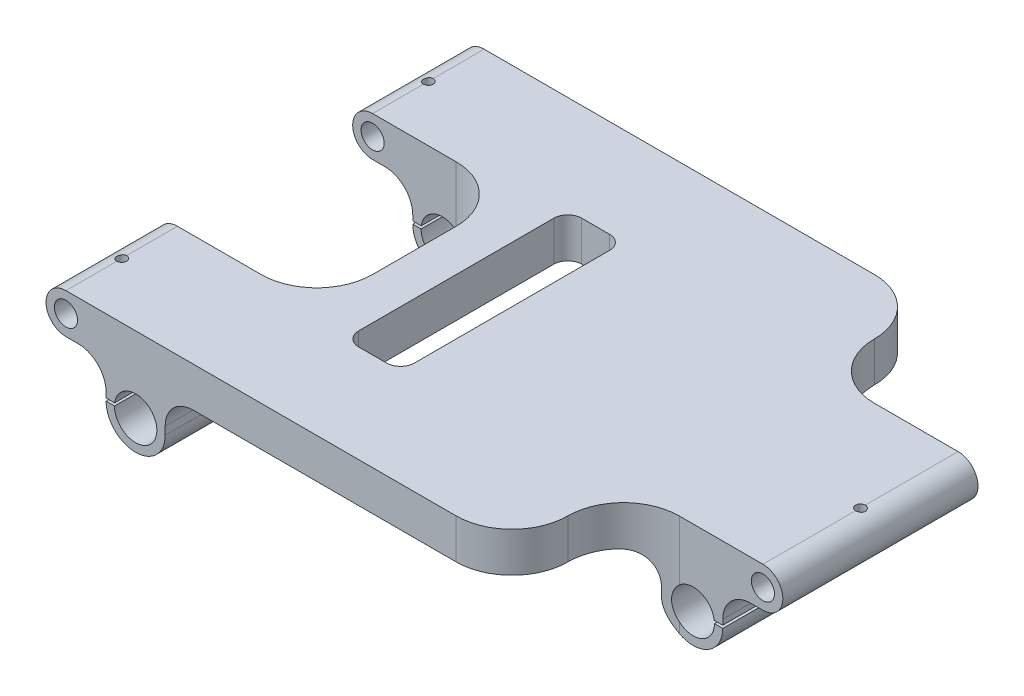
from build123d import *

# Parameters (mm, degrees)
SKETCH5_R               = 7.6
SKETCH5_R_2             = 4.15
BOSS_EXTRUDE4_DEPTH     = 150
SKETCH7_W               = 89.175042466
SKETCH7_H               = 70
SKETCH7_W_2             = 124.051198178
SKETCH7_H_2             = 59.101732651
SKETCH7_W_3             = 92.104965072
SKETCH7_H_3             = 69.542958169
CUT_EXTRUDE3_DEPTH      = 150
FILLET2_R               = 20
FILLET3_R               = 20
FILLET4_R               = 20
CUT_EXTRUDE4_START      = -12.85
CUT_EXTRUDE4_DEPTH      = 12.85
FILLET6_R               = 10
SKETCH12_R              = 1.75
CUT_EXTRUDE8_DEPTH      = 208
CUT_EXTRUDE9_DEPTH      = 20
SKETCH15_W              = 150
SKETCH15_H              = 1
CUT_EXTRUDE_THIN1_DEPTH = 10
SKETCH16_W              = 70
SKETCH16_H              = 1
CUT_EXTRUDE_THIN2_DEPTH = 10


with BuildPart() as part:
    # Sketch5 → Boss-Extrude4 (new body)
    with BuildSketch(Plane.XY):
        with BuildLine():
            Line((-90.6, 0), (-90.6, 12.85))
            Line((-90.6, 12.85), (-105, 12.85))
            ThreePointArc((-105, 12.85), (-112.15, 20), (-105, 27.15))
            Line((-105, 27.15), (105, 27.15))
            ThreePointArc((105, 27.15), (112.15, 20), (105, 12.85))
            Line((105, 12.85), (90.6, 12.85))
            Line((90.6, 12.85), (90.6, 0))
            ThreePointArc((90.6, 0), (87.495331881, -7.495331881), (80, -10.6))
            ThreePointArc((80, -10.6), (72.504668119, -7.495331881), (69.4, 0))
            Line((69.4, 0), (-69.4, 0))
            ThreePointArc((-69.4, 0), (-72.504668119, -7.495331881), (-80, -10.6))
            ThreePointArc((-80, -10.6), (-87.495331881, -7.495331881), (-90.6, 0))
        make_face()
        with Locations((-80, 0)):
            Circle(SKETCH5_R, mode=Mode.SUBTRACT)
        with Locations((80, 0)):
            Circle(SKETCH5_R, mode=Mode.SUBTRACT)
        with Locations((-105, 20)):
            Circle(SKETCH5_R_2, mode=Mode.SUBTRACT)
        with Locations((105, 20)):
            Circle(SKETCH5_R_2, mode=Mode.SUBTRACT)
    extrude(amount=BOSS_EXTRUDE4_DEPTH)

    # Sketch7 → Cut-Extrude3 (cut)
    with BuildSketch(Plane(origin=(0, 27.15, 0), x_dir=(1, 0, 0), z_dir=(0, 1, 0))):
        with Locations((-99.587521233, -75)):
            Rectangle(SKETCH7_W, SKETCH7_H)
        with Locations((117.025599089, -139.550866326)):
            Rectangle(SKETCH7_W_2, SKETCH7_H_2)
        with Locations((101.052482536, -5.228520915)):
            Rectangle(SKETCH7_W_3, SKETCH7_H_3)
    extrude(amount=-CUT_EXTRUDE3_DEPTH, mode=Mode.SUBTRACT)

    # Fillet2
    fillet2_edges = [part.edges().sort_by_distance(p)[0] for p in [
        (55, 13.575, 0),
        (55, 13.575, 150),
    ]]
    fillet(fillet2_edges, radius=FILLET2_R)

    # Fillet3
    # the kernel refuses this fillet: 20 mm, written as the material it adds along each edge
    with BuildSketch(Plane(origin=(55, 27.15, 40), x_dir=(0, 0, -1), z_dir=(0, -1, 0))) as fillet3_piece_1_section:
        with BuildLine():
            CenterArc((FILLET3_R, FILLET3_R), FILLET3_R, 180, 90)
            Line((0, FILLET3_R), (0, 0))
            Line((0, 0), (FILLET3_R, 0))
        make_face()
    fillet3_piece_1 = extrude(amount=27.15, mode=Mode.PRIVATE)
    fillet3_piece_1 = fillet3_piece_1 - Plane(origin=(80, 0, 35.43535288), x_dir=(1, 0, 0), z_dir=(0, 0, -1)) * Cylinder(10.6, 135, mode=Mode.PRIVATE)
    add(fillet3_piece_1)
    with BuildSketch(Plane(origin=(55, 27.15, 40), x_dir=(0, 0, -1), z_dir=(0, -1, 0))) as fillet3_piece_2_section:
        with BuildLine():
            CenterArc((FILLET3_R, FILLET3_R), FILLET3_R, 180, 90)
            Line((0, FILLET3_R), (0, 0))
            Line((0, 0), (FILLET3_R, 0))
        make_face()
    fillet3_piece_2 = extrude(amount=27.15, mode=Mode.PRIVATE)
    fillet3_piece_2 = fillet3_piece_2 & Plane(origin=(80, 0, 40.045862932), x_dir=(1, 0, 0), z_dir=(0, 0, -1)) * Cylinder(10.6, 135, mode=Mode.PRIVATE)
    fillet3_piece_2 = fillet3_piece_2 - Plane(origin=(80, 0, 40.045862932), x_dir=(1, 0, 0), z_dir=(0, 0, -1)) * Cylinder(7.6, 135, mode=Mode.PRIVATE)
    add(fillet3_piece_2)
    with BuildSketch(Plane(origin=(55, 27.15, 40), x_dir=(0, 0, -1), z_dir=(0, -1, 0))) as fillet3_piece_3_section:
        with BuildLine():
            CenterArc((FILLET3_R, FILLET3_R), FILLET3_R, 180, 90)
            Line((0, FILLET3_R), (0, 0))
            Line((0, 0), (FILLET3_R, 0))
        make_face()
    fillet3_piece_3 = extrude(amount=77.15, mode=Mode.PRIVATE)
    fillet3_piece_3 = split(fillet3_piece_3, bisect_by=Plane(origin=(71.797755261, 0, 40.045862905), z_dir=(0, -1, 0)), keep=Keep.TOP, mode=Mode.PRIVATE)
    fillet3_piece_3 = fillet3_piece_3 & Plane(origin=(80, 0, 40.045862905), x_dir=(1, 0, 0), z_dir=(0, 0, -1)) * Cylinder(10.6, 235, mode=Mode.PRIVATE)
    fillet3_piece_3 = fillet3_piece_3 - Plane(origin=(80, 0, 40.045862905), x_dir=(1, 0, 0), z_dir=(0, 0, -1)) * Cylinder(7.6, 235, mode=Mode.PRIVATE)
    add(fillet3_piece_3)
    with BuildSketch(Plane(origin=(55, 27.15, 110), x_dir=(1, 0, 0), z_dir=(0, -1, 0))) as fillet3_piece_4_section:
        with BuildLine():
            CenterArc((FILLET3_R, FILLET3_R), FILLET3_R, 180, 90)
            Line((0, FILLET3_R), (0, 0))
            Line((0, 0), (FILLET3_R, 0))
        make_face()
    fillet3_piece_4 = extrude(amount=27.15, mode=Mode.PRIVATE)
    fillet3_piece_4 = fillet3_piece_4 - Plane(origin=(80, 0, 114.564647062), x_dir=(1, 0, 0), z_dir=(0, 0, -1)) * Cylinder(10.6, 135, mode=Mode.PRIVATE)
    add(fillet3_piece_4)
    with BuildSketch(Plane(origin=(55, 27.15, 110), x_dir=(1, 0, 0), z_dir=(0, -1, 0))) as fillet3_piece_5_section:
        with BuildLine():
            CenterArc((FILLET3_R, FILLET3_R), FILLET3_R, 180, 90)
            Line((0, FILLET3_R), (0, 0))
            Line((0, 0), (FILLET3_R, 0))
        make_face()
    fillet3_piece_5 = extrude(amount=27.15, mode=Mode.PRIVATE)
    fillet3_piece_5 = fillet3_piece_5 & Plane(origin=(80, 0, 109.954137067), x_dir=(1, 0, 0), z_dir=(0, 0, -1)) * Cylinder(10.6, 135, mode=Mode.PRIVATE)
    fillet3_piece_5 = fillet3_piece_5 - Plane(origin=(80, 0, 109.954137067), x_dir=(1, 0, 0), z_dir=(0, 0, -1)) * Cylinder(7.6, 135, mode=Mode.PRIVATE)
    add(fillet3_piece_5)
    with BuildSketch(Plane(origin=(55, 27.15, 110), x_dir=(1, 0, 0), z_dir=(0, -1, 0))) as fillet3_piece_6_section:
        with BuildLine():
            CenterArc((FILLET3_R, FILLET3_R), FILLET3_R, 180, 90)
            Line((0, FILLET3_R), (0, 0))
            Line((0, 0), (FILLET3_R, 0))
        make_face()
    fillet3_piece_6 = extrude(amount=77.15, mode=Mode.PRIVATE)
    fillet3_piece_6 = split(fillet3_piece_6, bisect_by=Plane(origin=(71.797755212, 0, 109.954137092), z_dir=(0, -1, 0)), keep=Keep.TOP, mode=Mode.PRIVATE)
    fillet3_piece_6 = fillet3_piece_6 & Plane(origin=(80, 0, 109.954137092), x_dir=(1, 0, 0), z_dir=(0, 0, -1)) * Cylinder(10.6, 235, mode=Mode.PRIVATE)
    fillet3_piece_6 = fillet3_piece_6 - Plane(origin=(80, 0, 109.954137092), x_dir=(1, 0, 0), z_dir=(0, 0, -1)) * Cylinder(7.6, 235, mode=Mode.PRIVATE)
    add(fillet3_piece_6)

    # Fillet4
    # the kernel refuses this fillet: 20 mm, written as the material it adds along each edge
    with BuildSketch(Plane(origin=(-55, 27.15, 40), x_dir=(-1, 0, 0), z_dir=(0, -1, 0))) as fillet4_piece_1_section:
        with BuildLine():
            CenterArc((FILLET4_R, -FILLET4_R), FILLET4_R, 90, 90)
            Line((0, -FILLET4_R), (0, 0))
            Line((0, 0), (FILLET4_R, 0))
        make_face()
    fillet4_piece_1 = extrude(amount=27.15, mode=Mode.PRIVATE)
    fillet4_piece_1 = fillet4_piece_1 - Plane(origin=(-80, 0, 44.564647072), x_dir=(0, -1, 0), z_dir=(0, 0, -1)) * Cylinder(10.6, 135, mode=Mode.PRIVATE)
    add(fillet4_piece_1)
    with BuildSketch(Plane(origin=(-55, 27.15, 40), x_dir=(-1, 0, 0), z_dir=(0, -1, 0))) as fillet4_piece_2_section:
        with BuildLine():
            CenterArc((FILLET4_R, -FILLET4_R), FILLET4_R, 90, 90)
            Line((0, -FILLET4_R), (0, 0))
            Line((0, 0), (FILLET4_R, 0))
        make_face()
    fillet4_piece_2 = extrude(amount=27.15, mode=Mode.PRIVATE)
    fillet4_piece_2 = fillet4_piece_2 & Plane(origin=(-80, 0, 39.954137092), x_dir=(0, -1, 0), z_dir=(0, 0, -1)) * Cylinder(10.6, 135, mode=Mode.PRIVATE)
    fillet4_piece_2 = fillet4_piece_2 - Plane(origin=(-80, 0, 39.954137092), x_dir=(1, 0, 0), z_dir=(0, 0, -1)) * Cylinder(7.6, 135, mode=Mode.PRIVATE)
    add(fillet4_piece_2)
    with BuildSketch(Plane(origin=(-55, 27.15, 40), x_dir=(-1, 0, 0), z_dir=(0, -1, 0))) as fillet4_piece_3_section:
        with BuildLine():
            CenterArc((FILLET4_R, -FILLET4_R), FILLET4_R, 90, 90)
            Line((0, -FILLET4_R), (0, 0))
            Line((0, 0), (FILLET4_R, 0))
        make_face()
    fillet4_piece_3 = extrude(amount=77.15, mode=Mode.PRIVATE)
    fillet4_piece_3 = split(fillet4_piece_3, bisect_by=Plane(origin=(-71.797755148, 0, 39.954137066), z_dir=(0, -1, 0)), keep=Keep.TOP, mode=Mode.PRIVATE)
    fillet4_piece_3 = fillet4_piece_3 & Plane(origin=(-80, 0, 39.954137066), x_dir=(0, -1, 0), z_dir=(0, 0, -1)) * Cylinder(10.6, 235, mode=Mode.PRIVATE)
    fillet4_piece_3 = fillet4_piece_3 - Plane(origin=(-80, 0, 39.954137066), x_dir=(1, 0, 0), z_dir=(0, 0, -1)) * Cylinder(7.6, 235, mode=Mode.PRIVATE)
    add(fillet4_piece_3)
    with BuildSketch(Plane(origin=(-55, 27.15, 110), x_dir=(0, 0, -1), z_dir=(0, -1, 0))) as fillet4_piece_4_section:
        with BuildLine():
            CenterArc((FILLET4_R, -FILLET4_R), FILLET4_R, 90, 90)
            Line((0, -FILLET4_R), (0, 0))
            Line((0, 0), (FILLET4_R, 0))
        make_face()
    fillet4_piece_4 = extrude(amount=27.15, mode=Mode.PRIVATE)
    fillet4_piece_4 = fillet4_piece_4 - Plane(origin=(-80, 0, 105.435352744), x_dir=(0, -1, 0), z_dir=(0, 0, -1)) * Cylinder(10.6, 135, mode=Mode.PRIVATE)
    add(fillet4_piece_4)
    with BuildSketch(Plane(origin=(-55, 27.15, 110), x_dir=(0, 0, -1), z_dir=(0, -1, 0))) as fillet4_piece_5_section:
        with BuildLine():
            CenterArc((FILLET4_R, -FILLET4_R), FILLET4_R, 90, 90)
            Line((0, -FILLET4_R), (0, 0))
            Line((0, 0), (FILLET4_R, 0))
        make_face()
    fillet4_piece_5 = extrude(amount=27.15, mode=Mode.PRIVATE)
    fillet4_piece_5 = fillet4_piece_5 & Plane(origin=(-80, 0, 110.045862902), x_dir=(0, -1, 0), z_dir=(0, 0, -1)) * Cylinder(10.6, 135, mode=Mode.PRIVATE)
    fillet4_piece_5 = fillet4_piece_5 - Plane(origin=(-80, 0, 110.045862902), x_dir=(1, 0, 0), z_dir=(0, 0, -1)) * Cylinder(7.6, 135, mode=Mode.PRIVATE)
    add(fillet4_piece_5)
    with BuildSketch(Plane(origin=(-55, 27.15, 110), x_dir=(0, 0, -1), z_dir=(0, -1, 0))) as fillet4_piece_6_section:
        with BuildLine():
            CenterArc((FILLET4_R, -FILLET4_R), FILLET4_R, 90, 90)
            Line((0, -FILLET4_R), (0, 0))
            Line((0, 0), (FILLET4_R, 0))
        make_face()
    fillet4_piece_6 = extrude(amount=77.15, mode=Mode.PRIVATE)
    fillet4_piece_6 = split(fillet4_piece_6, bisect_by=Plane(origin=(-71.797755205, 0, 110.04586293), z_dir=(0, -1, 0)), keep=Keep.TOP, mode=Mode.PRIVATE)
    fillet4_piece_6 = fillet4_piece_6 & Plane(origin=(-80, 0, 110.04586293), x_dir=(0, -1, 0), z_dir=(0, 0, -1)) * Cylinder(10.6, 235, mode=Mode.PRIVATE)
    fillet4_piece_6 = fillet4_piece_6 - Plane(origin=(-80, 0, 110.04586293), x_dir=(1, 0, 0), z_dir=(0, 0, -1)) * Cylinder(7.6, 235, mode=Mode.PRIVATE)
    add(fillet4_piece_6)

    # Sketch8 → Cut-Extrude4 (cut)
    with BuildSketch(Plane.XZ.offset(CUT_EXTRUDE4_START)):
        with BuildLine():
            Line((-69.4, 0), (35, 0))
            ThreePointArc((35, 0), (49.142135624, 5.857864376), (55, 20))
            ThreePointArc((55, 20), (59, 32), (69.4, 39.2))
            Line((69.4, 39.2), (69.4, 110.8))
            ThreePointArc((69.4, 110.8), (59, 118), (55, 130))
            ThreePointArc((55, 130), (49.142135624, 144.142135624), (35, 150))
            Line((35, 150), (-69.4, 150))
            Line((-69.4, 150), (-69.4, 109.2))
            ThreePointArc((-69.4, 109.2), (-59, 102), (-55, 90))
            Line((-55, 90), (-55, 60))
            ThreePointArc((-55, 60), (-59, 48), (-69.4, 40.8))
            Line((-69.4, 40.8), (-69.4, 0))
        make_face()
    extrude(amount=CUT_EXTRUDE4_DEPTH, mode=Mode.SUBTRACT)

    # Fillet6
    fillet6_edges = [part.edges().sort_by_distance(p)[0] for p in [
        (69.4, 12.85, 75),
        (-69.4, 12.85, 129.6),
        (-69.4, 12.85, 20.4),
        (-90.6, 12.85, 130),
        (-90.6, 12.85, 20),
        (90.6, 12.85, 75),
    ]]
    fillet(fillet6_edges, radius=FILLET6_R)

    # Sketch12 → Cut-Extrude8 (cut)
    with BuildSketch(Plane(origin=(0, 27.15, 0), x_dir=(1, 0, 0), z_dir=(0, 1, 0))):
        with Locations(Location((-105, -20, 0), (0, 0, 270))):
            Circle(SKETCH12_R)
        with Locations(Location((-105, -130, 0), (0, 0, 270))):
            Circle(SKETCH12_R)
        with Locations(Location((105, -75, 0), (0, 0, 270))):
            Circle(SKETCH12_R)
    extrude(amount=-CUT_EXTRUDE8_DEPTH, mode=Mode.SUBTRACT)

    # Sketch13 → Cut-Extrude9 (cut)
    with BuildSketch(Plane(origin=(0, 12.85, 0), x_dir=(-1, 0, 0), z_dir=(0, -1, 0))):
        with BuildLine():
            Line((25, -35), (35, -35))
            ThreePointArc((35, -35), (38.535533906, -36.464466094), (40, -40))
            Line((40, -40), (40, -110))
            ThreePointArc((40, -110), (38.535533906, -113.535533906), (35, -115))
            Line((35, -115), (25, -115))
            ThreePointArc((25, -115), (21.464466094, -113.535533906), (20, -110))
            Line((20, -110), (20, -40))
            ThreePointArc((20, -40), (21.464466094, -36.464466094), (25, -35))
        make_face()
    extrude(amount=-CUT_EXTRUDE9_DEPTH, mode=Mode.SUBTRACT)

    # Sketch15 → Cut-Extrude-Thin1 (cut)
    with BuildSketch(Plane.ZY.offset(90.6)):
        with Locations((75, 0.5)):
            Rectangle(SKETCH15_W, SKETCH15_H)
    extrude(amount=-CUT_EXTRUDE_THIN1_DEPTH, mode=Mode.SUBTRACT)

    # Sketch16 → Cut-Extrude-Thin2 (cut)
    with BuildSketch(Plane(origin=(90.6, 0, 0), x_dir=(0, 0, -1), z_dir=(1, 0, 0))):
        with Locations((-75, 0.5)):
            Rectangle(SKETCH16_W, SKETCH16_H)
    extrude(amount=-CUT_EXTRUDE_THIN2_DEPTH, mode=Mode.SUBTRACT)


solid = part.part
